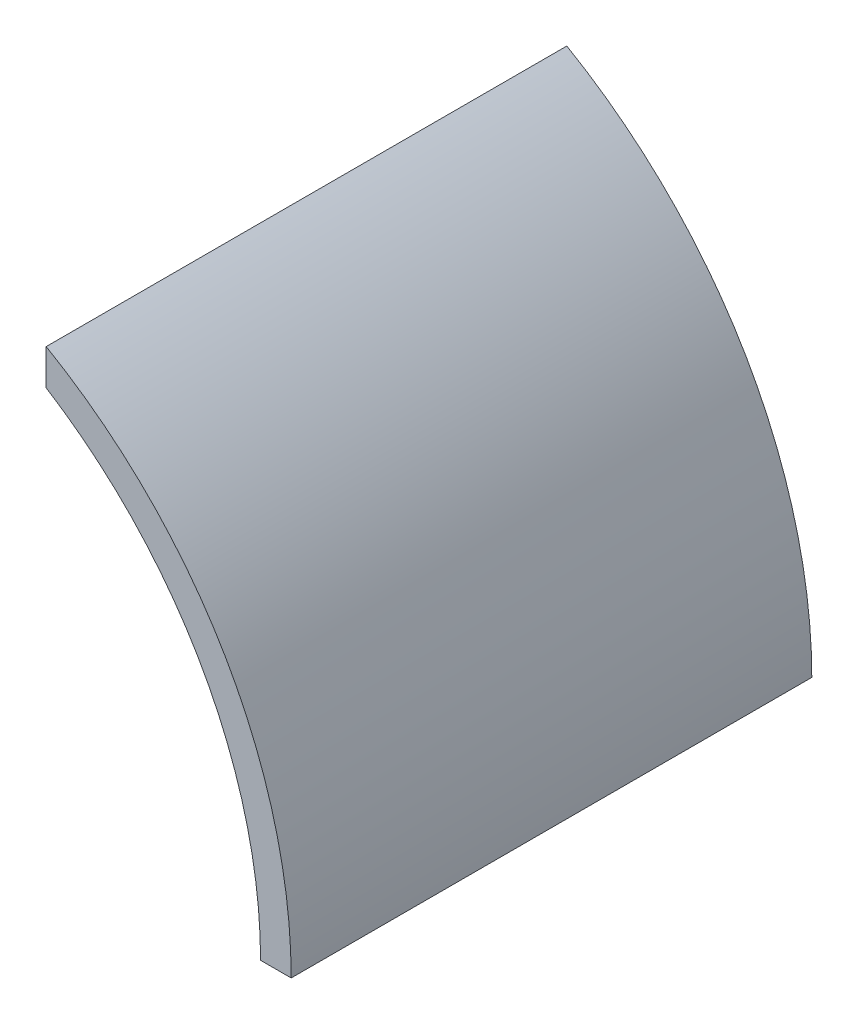
from build123d import *

# Parameters (mm, degrees)
INNER_RING_RIGHT_SIDE_DEPTH = 170


with BuildPart() as part:
    # Sketch2 → Inner Ring - Right Side (new body)
    with BuildSketch(Plane.XY):
        with BuildLine():
            Line((80, 138.564064606), (80, 126.885775404))
            ThreePointArc((80, 126.885775404), (131.339255366, 72.456883731), (150, 0))
            Line((150, 0), (160, 0))
            ThreePointArc((160, 0), (138.564064606, 80), (80, 138.564064606))
        make_face()
    extrude(amount=INNER_RING_RIGHT_SIDE_DEPTH)


solid = part.part
